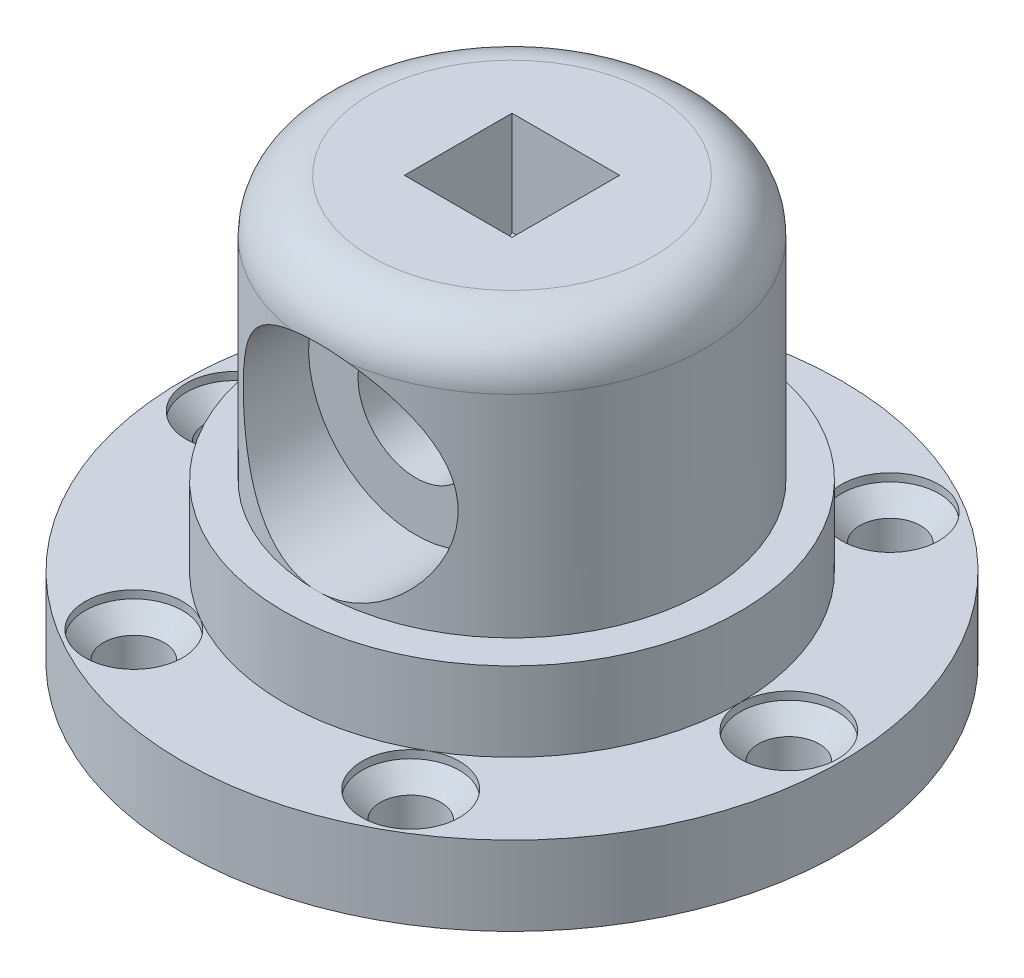
from build123d import *

# Parameters (mm, degrees)
SKETCH_1_R               = 12.5
EXTRUDE_1_DEPTH          = 6
SKETCH_4_R               = 1.15
CUT_EXTRUDE_2_DEPTH      = 19
SKETCH_3_R               = 7.5
CUT_EXTRUDE_3_DEPTH      = 5
CHAMFER_2_SIZE           = 0.7
SKETCH_8_R               = 17.454292773
SKETCH_8_R_2             = 8.65
CUT_EXTRUDE_4_DEPTH      = 3
PATTERN_CIRCULAR_2_COUNT = 6
SKETCH_2_R               = 7.34982993
EXTRUDE_2_DEPTH          = 10
SKETCH_9_R               = 1.85
CUT_EXTRUDE_5_DEPTH      = 0.3
CHAMFER_3_SIZE           = 0.7
PATTERN_CIRCULAR_3_COUNT = 6
CHAMFER_4_SIZE           = 0.7
SKETCH_10_W              = 4.08
SKETCH_10_H              = 4.08
CUT_EXTRUDE_6_DEPTH      = 8
FILLET_1_R               = 2
CHAMFER_5_SIZE           = 4.08


# Some blends are built 0.0001 mm under size
with BuildPart() as part:
    # 草图1 → 凸台-拉伸1 (new body)
    with BuildSketch(Plane(origin=(0, 0, 0), x_dir=(1, 0, 0), z_dir=(0, 1, 0))):
        with Locations(Location((0, 0, 0), (0, 0, 270))):
            Circle(SKETCH_1_R)
    extrude(amount=EXTRUDE_1_DEPTH)

    # 草图4 → 切除-拉伸2 (cut)
    with BuildSketch(Plane(origin=(0, 6, 0), x_dir=(1, 0, 0), z_dir=(0, 1, 0))):
        with Locations(Location((-10.5, 0, 0), (0, 0, 270))):
            Circle(SKETCH_4_R)
    cut_extrude_2 = extrude(amount=-CUT_EXTRUDE_2_DEPTH, mode=Mode.SUBTRACT)

    # 草图3 → 切除-拉伸3 (cut)
    with BuildSketch(Plane(origin=(0, 0, 0), x_dir=(-1, 0, 0), z_dir=(0, -1, 0))):
        with Locations(Location((0, 0, 0), (0, 0, 90))):
            Circle(SKETCH_3_R)
    extrude(amount=-CUT_EXTRUDE_3_DEPTH, mode=Mode.SUBTRACT)

    # 倒角2
    chamfer_2_edges = [part.edges().sort_by_distance(p)[0] for p in [
        (-10.5, 6, -1.15),
    ]]
    chamfer(chamfer_2_edges, length=CHAMFER_2_SIZE)

    # 草图8 → 切除-拉伸4 (cut)
    with BuildSketch(Plane(origin=(0, 6, 0), x_dir=(1, 0, 0), z_dir=(0, 1, 0))):
        Circle(SKETCH_8_R)
        with Locations(Location((0, 0, 0), (0, 0, 270))):
            Circle(SKETCH_8_R_2, mode=Mode.SUBTRACT)
    extrude(amount=-CUT_EXTRUDE_4_DEPTH, mode=Mode.SUBTRACT)

    # 阵列(圆周)2: 切除-拉伸2 ×6 about axis
    pattern_circular_2_axis = Axis((0, 0, 0), (0, 1, 0))
    for i in range(1, PATTERN_CIRCULAR_2_COUNT):
        add(cut_extrude_2.rotate(pattern_circular_2_axis, i * 360 / PATTERN_CIRCULAR_2_COUNT), mode=Mode.SUBTRACT)

    # 草图2 → 凸台-拉伸2 (add)
    with BuildSketch(Plane(origin=(0, 6, 0), x_dir=(1, 0, 0), z_dir=(0, 1, 0))):
        with Locations(Location((0, 0, 0), (0, 0, 270))):
            Circle(SKETCH_2_R)
    extrude(amount=EXTRUDE_2_DEPTH)

    # 草图9 → 切除-拉伸5 (cut)
    with BuildSketch(Plane(origin=(0, 3, 0), x_dir=(1, 0, 0), z_dir=(0, 1, 0))):
        with Locations(Location((-10.5, 0, 0), (0, 0, 270))):
            Circle(SKETCH_9_R)
    cut_extrude_5 = extrude(amount=-CUT_EXTRUDE_5_DEPTH, mode=Mode.SUBTRACT)

    # 倒角3
    chamfer_3_edges = [part.edges().sort_by_distance(p)[0] for p in [
        (-10.5, 2.7, -1.15),
    ]]
    chamfer(chamfer_3_edges, length=CHAMFER_3_SIZE - 0.0001)  # a hair under: the kernel refuses the full size

    # 阵列(圆周)3: 切除-拉伸5 ×6 about axis
    pattern_circular_3_axis = Axis((0, 0, 0), (0, 1, 0))
    for i in range(1, PATTERN_CIRCULAR_3_COUNT):
        add(cut_extrude_5.rotate(pattern_circular_3_axis, i * 360 / PATTERN_CIRCULAR_3_COUNT), mode=Mode.SUBTRACT)

    # 倒角4
    chamfer_4_edges = [part.edges().sort_by_distance(p)[0] for p in [
        (-4.254070786, 2.7, -9.66826674),
        (6.245929214, 2.7, -8.51826674),
        (10.5, 2.7, 1.15),
        (4.254070786, 2.7, 9.66826674),
        (-6.245929214, 2.7, 8.51826674),
    ]]
    chamfer(chamfer_4_edges, length=CHAMFER_4_SIZE - 0.0001)  # a hair under: the kernel refuses the full size

    # 草图10 → 切除-拉伸6 (cut)
    with BuildSketch(Plane(origin=(0, 16, 0), x_dir=(1, 0, 0), z_dir=(0, 1, 0))):
        Rectangle(SKETCH_10_W, SKETCH_10_H)
    extrude(amount=-CUT_EXTRUDE_6_DEPTH, mode=Mode.SUBTRACT)

    # 草图11 → 切除-旋转1 (revolve, cut)
    with BuildSketch(Plane(origin=(0, 0, 0), x_dir=(0, 0, -1), z_dir=(1, 0, 0)), mode=Mode.PRIVATE) as cut_revolve_1_sk:
        Polygon((-0.304897272, 10.075), (-10.874100718, 10.075), (-10.874100718, 6), (-3.64, 6), (-3.64, 7.875), (-2.04, 7.875), (-2.04, 9.125), (11.125701635, 9.125), (11.125701635, 10.075), align=None)
    revolve(cut_revolve_1_sk.sketch.rotate(Axis((0, 10.075, 0.304897272), (0, 0, 1)), 180), axis=Axis((0, 10.075, 0.304897272), (0, 0, 1)), mode=Mode.SUBTRACT)

    # 圆角1
    # the kernel refuses this fillet: 2 mm, written as the material it takes off along each edge
    with BuildSketch(Plane(origin=(0, 16, 0), x_dir=(0, 0, 1), z_dir=(-1, 0, 0))) as fillet_1_piece_1:
        with BuildLine():
            CenterArc((7.34982993 - FILLET_1_R, -FILLET_1_R), FILLET_1_R, 0, 90)
            Line((7.34982993 - FILLET_1_R, 0), (7.34982993, 0))
            Line((7.34982993, 0), (7.34982993, -FILLET_1_R))
        make_face()
    revolve(axis=Axis((0, 16, 0), (0, 1, 0)), mode=Mode.SUBTRACT)

    # 倒角5
    # the kernel refuses this chamfer: 4.08 mm, written as the material it adds along each edge
    with BuildSketch(Plane(origin=(2.04, 8, -2.04), x_dir=(0, 0.9996219169112968, -0.02749587661058642), z_dir=(-1, 0, 0))) as chamfer_5_piece_1_section:
        Polygon((CHAMFER_5_SIZE * 0.999621916911, -CHAMFER_5_SIZE * 0.0274958766106), (-CHAMFER_5_SIZE * 0.0274958766106, -CHAMFER_5_SIZE * 0.999621916911), (0, 0), align=None)
    chamfer_5_piece_1 = extrude(amount=4.08, mode=Mode.PRIVATE)
    chamfer_5_piece_1 = chamfer_5_piece_1 - Plane(origin=(0, 10.075, -1.478470711), x_dir=(0, 1, 0), z_dir=(0, 0, -1)) * Cylinder(0.95, 25, mode=Mode.PRIVATE)
    add(chamfer_5_piece_1)


solid = part.part
